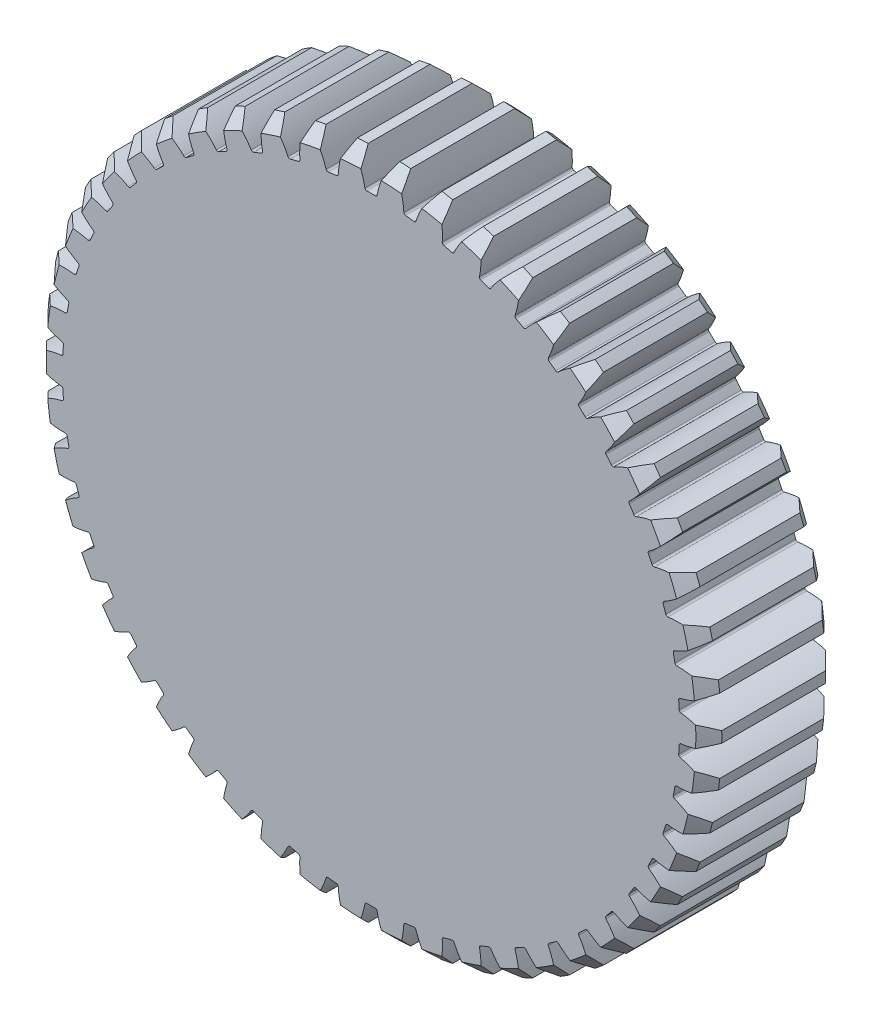
from build123d import *

# Parameters (mm, degrees)
SKETCH_960_R                     = 52
EXTRUDE_980_DEPTH                = 10
CHAMFER_1018_SIZE                = 2
CUT_EXTRUDE_1328_DEPTH           = 10
FILLET_2_R                       = 0.3
PATTERN_CIRCULAR_2_COUNT         = 50
FILLET_2_OF_PATTERN_CIRCULAR_2_R = 0.3


with BuildPart() as part:
    # Sketch 960 → Extrude 980 (new, symmetric)
    with BuildSketch(Plane.XY):
        Circle(SKETCH_960_R)
    extrude(amount=EXTRUDE_980_DEPTH, both=True)

    # Chamfer 1018
    chamfer_1018_edges = [part.edges().sort_by_distance(p)[0] for p in [
        (-52, 0, -10),
        (-52, 0, 10),
    ]]
    chamfer(chamfer_1018_edges, length=CHAMFER_1018_SIZE)

    # 草图2 → Cut-Extrude 1328 (cut, symmetric)
    with BuildSketch(Plane.XY):
        with BuildLine():
            add(Edge.make_bspline(
                [(-0.904830094, 47.491381139), (-0.911706253, 47.54031168), (-0.932307327, 47.677521771), (-0.971568727, 47.902229849), (-1.051172812, 48.283389304), (-1.173833909, 48.769410734), (-1.337508953, 49.318752284), (-1.547869916, 49.928545283), (-1.834446998, 50.66682373), (-2.088883788, 51.244008758), (-2.290972756, 51.66767574), (-2.428738119, 51.943250102)],
                knots=[0.002027097, 0.002027097, 0.002027097, 0.002027097, 0.002027097, 0.002802034, 0.004203051, 0.005604068, 0.008132613, 0.010661158, 0.013189703, 0.015718248, 0.020550166, 0.020550166, 0.020550166, 0.020550166, 0.020550166], degree=4))
            ThreePointArc((-0.904830094, 47.491381139), (0, 47.5), (0.904830094, 47.491381139))
            add(Edge.make_bspline(
                [(0.904830094, 47.491381139), (0.911706253, 47.54031168), (0.932307327, 47.677521771), (0.971568727, 47.902229849), (1.051172812, 48.283389304), (1.173833909, 48.769410734), (1.337508953, 49.318752284), (1.547869916, 49.928545283), (1.834446998, 50.66682373), (2.088883788, 51.244008758), (2.290972756, 51.66767574), (2.428738119, 51.943250102)],
                knots=[0.002027097, 0.002027097, 0.002027097, 0.002027097, 0.002027097, 0.002802034, 0.004203051, 0.005604068, 0.008132613, 0.010661158, 0.013189703, 0.015718248, 0.020550166, 0.020550166, 0.020550166, 0.020550166, 0.020550166], degree=4))
            ThreePointArc((2.428738119, 51.943250102), (0, 52), (-2.428738119, 51.943250102))
        make_face()
    cut_extrude_1328 = extrude(amount=CUT_EXTRUDE_1328_DEPTH, both=True, mode=Mode.SUBTRACT)

    # 圆角2
    fillet_2_edges = [part.edges().sort_by_distance(p)[0] for p in [
        (0.904830094, 47.491381139, -5),
        (-0.904830094, 47.491381139, -5),
    ]]
    fillet(fillet_2_edges, radius=FILLET_2_R)

    # 圆周阵列2: Cut-Extrude 1328 ×50 about axis
    pattern_circular_2_axis = Axis((0, 0, 10), (0, 0, -1))
    for i in range(1, PATTERN_CIRCULAR_2_COUNT):
        add(cut_extrude_1328.rotate(pattern_circular_2_axis, i * 360 / PATTERN_CIRCULAR_2_COUNT), mode=Mode.SUBTRACT)

    # 圆角2 of 圆周阵列2
    fillet_2_of_pattern_circular_2_edges = [part.edges().sort_by_distance(p)[0] for p in [
        (6.849943603, 47.003492132, -5),
        (5.054553127, 47.230302695, -5),
        (12.687029409, 45.774329976, -5),
        (10.934223025, 46.224374164, -5),
        (18.324033183, 43.823279292, -5),
        (16.641453694, 44.489459639, -5),
        (23.672056007, 41.181109315, -5),
        (22.086238697, 42.052919759, -5),
        (28.646756367, 37.889488643, -5),
        (27.182710522, 38.953180213, -5),
        (33.169680267, 34.000328101, -5),
        (31.850494764, 35.239125745, -5),
        (37.169498494, 29.574962075, -5),
        (36.015977677, 30.969329214, -5),
        (40.583131525, 24.683181229, -5),
        (39.613467107, 26.211127861, -5),
        (43.35674433, 19.40213187, -5),
        (42.586228497, 21.039561363, -5),
        (45.446595376, 13.815099302, -5),
        (44.887379624, 15.536188415, -5),
        (46.819726465, 8.010194364, -5),
        (46.48062996, 9.787800494, -5),
        (47.454482498, 2.078963877, -5),
        (47.340852995, 3.885053113, -5),
        (47.340852995, -3.885053113, -5),
        (47.454482498, -2.078963877, -5),
        (46.48062996, -9.787800494, -5),
        (46.819726465, -8.010194364, -5),
        (44.887379624, -15.536188415, -5),
        (45.446595376, -13.815099302, -5),
        (42.586228497, -21.039561363, -5),
        (43.35674433, -19.40213187, -5),
        (39.613467107, -26.211127861, -5),
        (40.583131525, -24.683181229, -5),
        (36.015977677, -30.969329214, -5),
        (37.169498494, -29.574962075, -5),
        (31.850494764, -35.239125745, -5),
        (33.169680267, -34.000328101, -5),
        (27.182710522, -38.953180213, -5),
        (28.646756367, -37.889488643, -5),
        (22.086238697, -42.052919759, -5),
        (23.672056007, -41.181109315, -5),
        (16.641453694, -44.489459639, -5),
        (18.324033183, -43.823279292, -5),
        (10.934223025, -46.224374164, -5),
        (12.687029409, -45.774329976, -5),
        (5.054553127, -47.230302695, -5),
        (6.849943603, -47.003492132, -5),
        (-0.904830094, -47.491381139, -5),
        (0.904830094, -47.491381139, -5),
        (-6.849943603, -47.003492132, -5),
        (-5.054553127, -47.230302695, -5),
        (-12.687029409, -45.774329976, -5),
        (-10.934223025, -46.224374164, -5),
        (-18.324033183, -43.823279292, -5),
        (-16.641453694, -44.489459639, -5),
        (-23.672056007, -41.181109315, -5),
        (-22.086238697, -42.052919759, -5),
        (-28.646756367, -37.889488643, -5),
        (-27.182710522, -38.953180213, -5),
        (-33.169680267, -34.000328101, -5),
        (-31.850494764, -35.239125745, -5),
        (-37.169498494, -29.574962075, -5),
        (-36.015977677, -30.969329214, -5),
        (-40.583131525, -24.683181229, -5),
        (-39.613467107, -26.211127861, -5),
        (-43.35674433, -19.40213187, -5),
        (-42.586228497, -21.039561363, -5),
        (-45.446595376, -13.815099302, -5),
        (-44.887379624, -15.536188415, -5),
        (-46.819726465, -8.010194364, -5),
        (-46.48062996, -9.787800494, -5),
        (-47.454482498, -2.078963877, -5),
        (-47.340852995, -3.885053113, -5),
        (-47.340852995, 3.885053113, -5),
        (-47.454482498, 2.078963877, -5),
        (-46.48062996, 9.787800494, -5),
        (-46.819726465, 8.010194364, -5),
        (-44.887379624, 15.536188415, -5),
        (-45.446595376, 13.815099302, -5),
        (-42.586228497, 21.039561363, -5),
        (-43.35674433, 19.40213187, -5),
        (-39.613467107, 26.211127861, -5),
        (-40.583131525, 24.683181229, -5),
        (-36.015977677, 30.969329214, -5),
        (-37.169498494, 29.574962075, -5),
        (-31.850494764, 35.239125745, -5),
        (-33.169680267, 34.000328101, -5),
        (-27.182710522, 38.953180213, -5),
        (-28.646756367, 37.889488643, -5),
        (-22.086238697, 42.052919759, -5),
        (-23.672056007, 41.181109315, -5),
        (-16.641453694, 44.489459639, -5),
        (-18.324033183, 43.823279292, -5),
        (-10.934223025, 46.224374164, -5),
        (-12.687029409, 45.774329976, -5),
        (-5.054553127, 47.230302695, -5),
        (-6.849943603, 47.003492132, -5),
    ]]
    fillet(fillet_2_of_pattern_circular_2_edges, radius=FILLET_2_OF_PATTERN_CIRCULAR_2_R)


solid = part.part
